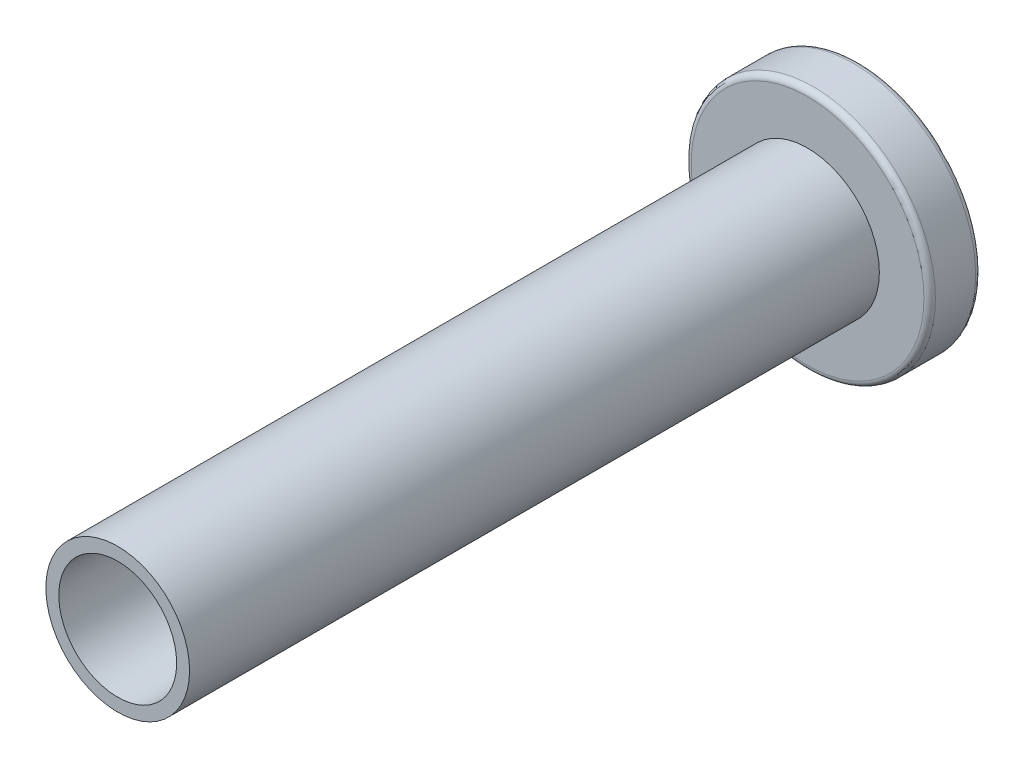
from build123d import *

# Parameters (mm, degrees)
SKETCH_1_R          = 4.25
EXTRUDE_1_DEPTH     = 1.8
SKETCH_2_R          = 2.5
SKETCH_2_R_2        = 2.05
EXTRUDE_2_DEPTH     = 24
FILLET_1_R          = 0.2
CUT_EXTRUDE_1_DEPTH = 1.5


with BuildPart() as part:
    # 草图1 → 凸台-拉伸1 (new body)
    with BuildSketch(Plane.XY):
        Circle(SKETCH_1_R)
    extrude(amount=EXTRUDE_1_DEPTH)

    # 草图2 → 凸台-拉伸2 (add)
    with BuildSketch(Plane.XY.offset(1.8)):
        Circle(SKETCH_2_R)
        Circle(SKETCH_2_R_2, mode=Mode.SUBTRACT)
    extrude(amount=EXTRUDE_2_DEPTH)

    # 圆角1
    fillet_1_edges = [part.edges().sort_by_distance(p)[0] for p in [
        (-4.25, 0, 0),
        (-4.25, 0, 1.8),
    ]]
    fillet(fillet_1_edges, radius=FILLET_1_R)

    # 草图3 → 切除-拉伸1 (cut)
    with BuildSketch(Plane(origin=(0, 0, 0), x_dir=(-1, 0, 0), z_dir=(0, 0, -1))):
        Polygon((1.443375673, 0), (0.721687836, 1.25), (-0.721687836, 1.25), (-1.443375673, 0), (-0.721687836, -1.25), (0.721687836, -1.25), align=None)
    extrude(amount=-CUT_EXTRUDE_1_DEPTH, mode=Mode.SUBTRACT)


solid = part.part
